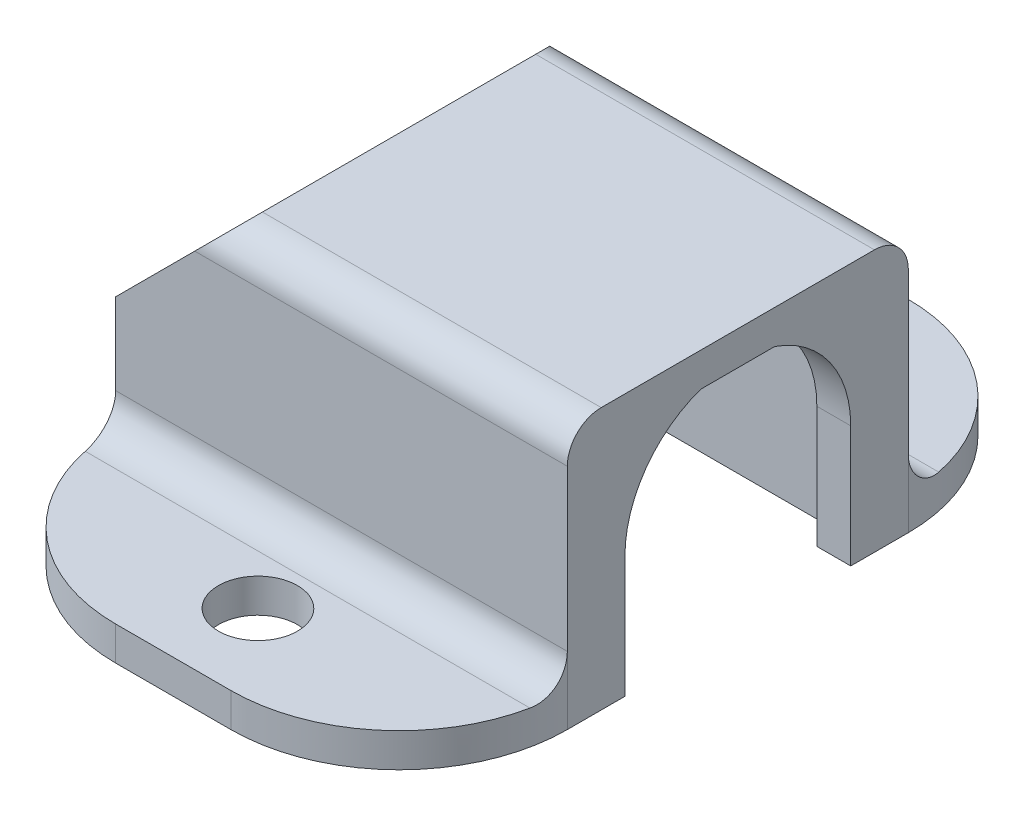
from build123d import *

# Parameters (mm, degrees)
BOSS_EXTRUDE1_DEPTH = 9.3
BOSS_EXTRUDE2_DEPTH = 9.2
BOSS_EXTRUDE3_DEPTH = 1.5
SKETCH4_R           = 1.75
CUT_EXTRUDE4_DEPTH  = 2
FILLET4_R           = 7.45
FILLET5_R           = 1.5
CHAMFER2_START      = -5
CHAMFER2_OUTLINE_W  = 10
CHAMFER2_OUTLINE_H  = 15.1
CHAMFER2_DEPTH      = 4.134035023


with BuildPart() as part:
    # Sketch3 → Boss-Extrude1 (new body)
    with BuildSketch(Plane(origin=(0, 0, 0), x_dir=(0, 0, -1), z_dir=(1, 0, 0))):
        with BuildLine():
            Line((-6.05, -5.375339764), (-6.05, -0.325229596))
            ThreePointArc((-6.05, -0.325229596), (-5.30143663, 2.555003374), (-3.26460533, 4.724659415))
            Line((-3.26460533, 4.724659415), (3.26460533, 4.724659415))
            ThreePointArc((3.26460533, 4.724659415), (5.30143663, 2.555003374), (6.05, -0.325229596))
            Line((6.05, -0.325229596), (6.05, -5.375339764))
            Line((6.05, -5.375339764), (15, -5.375339764))
            Line((15, -5.375339764), (15, -3.875339764))
            Line((15, -3.875339764), (7.55, -3.875339764))
            Line((7.55, -3.875339764), (7.55, 6.224659415))
            Line((7.55, 6.224659415), (-7.55, 6.224659415))
            Line((-7.55, 6.224659415), (-7.55, -3.875339764))
            Line((-7.55, -3.875339764), (-15, -3.875339764))
            Line((-15, -3.875339764), (-15, -5.375339764))
            Line((-15, -5.375339764), (-6.05, -5.375339764))
        make_face()
    extrude(amount=BOSS_EXTRUDE1_DEPTH)

    # Sketch9 → Boss-Extrude2 (add)
    with BuildSketch(Plane(origin=(9.3, 0, 0), x_dir=(0, 0, -1), z_dir=(1, 0, 0))):
        Polygon((7.55, -3.875339764), (7.55, 6.224659415), (-7.55, 6.224659415), (-7.55, -3.875339764), (-15, -3.875339764), (-15, -5.375339764), (-6.05, -5.375339764), (-6.05, 4.724659415), (6.05, 4.724659415), (6.05, -5.375339764), (15, -5.375339764), (15, -3.875339764), align=None)
    extrude(amount=BOSS_EXTRUDE2_DEPTH)

    # Sketch11 → Boss-Extrude3 (add)
    with BuildSketch(Plane(origin=(18.5, 0, 0), x_dir=(0, 0, -1), z_dir=(1, 0, 0))):
        with BuildLine():
            Line((-5, 0), (-5, -5.375339764))
            Line((-5, -5.375339764), (-15, -5.375339764))
            Line((-15, -5.375339764), (-15, -3.875339764))
            Line((-15, -3.875339764), (-7.55, -3.875339764))
            Line((-7.55, -3.875339764), (-7.55, 6.224659415))
            Line((-7.55, 6.224659415), (7.55, 6.224659415))
            Line((7.55, 6.224659415), (7.55, -3.875339764))
            Line((7.55, -3.875339764), (15, -3.875339764))
            Line((15, -3.875339764), (15, -5.375339764))
            Line((15, -5.375339764), (5, -5.375339764))
            Line((5, -5.375339764), (5, 0))
            ThreePointArc((5, 0), (4.07318529, 2.899855444), (1.636335361, 4.724659415))
            Line((1.636335361, 4.724659415), (-1.636335361, 4.724659415))
            ThreePointArc((-1.636335361, 4.724659415), (-4.07318529, 2.899855444), (-5, 0))
        make_face()
    extrude(amount=BOSS_EXTRUDE3_DEPTH)

    # Sketch4 → Cut-Extrude4 (cut)
    with BuildSketch(Plane(origin=(0, -3.875339764, 0), x_dir=(1, 0, 0), z_dir=(0, 1, 0))):
        with Locations(Location((10, -11.25, 0), (0, 0, 270))):
            Circle(SKETCH4_R)
        with Locations(Location((10, 11.25, 0), (0, 0, 270))):
            Circle(SKETCH4_R)
    extrude(amount=-CUT_EXTRUDE4_DEPTH, mode=Mode.SUBTRACT)

    # Fillet4
    fillet4_edges = [part.edges().sort_by_distance(p)[0] for p in [
        (0, -4.625339764, -15),
        (20, -4.625339764, -15),
        (20, -4.625339764, 15),
        (0, -4.625339764, 15),
    ]]
    fillet(fillet4_edges, radius=FILLET4_R)

    # Fillet5
    # the kernel refuses this fillet: 1.5 mm, written as the material it adds along each edge
    with BuildSketch(Plane(origin=(-3.75, -3.875339764, 7.55), x_dir=(0, 0, 1), z_dir=(1, 0, 0))) as fillet5_piece_1_section:
        with BuildLine():
            CenterArc((FILLET5_R, -FILLET5_R), FILLET5_R, 90, 90)
            Line((0, -FILLET5_R), (0, 0))
            Line((0, 0), (FILLET5_R, 0))
        make_face()
    fillet5_piece_1 = extrude(amount=27.5, mode=Mode.PRIVATE)
    fillet5_piece_1 = fillet5_piece_1 & Plane(origin=(7.45, -3.875339764, 7.55), x_dir=(-1, 0, 0), z_dir=(0, -1, 0)) * Cylinder(7.45, 61, mode=Mode.PRIVATE)
    add(fillet5_piece_1)
    with BuildSketch(Plane(origin=(-3.75, -3.875339764, 7.55), x_dir=(0, 0, 1), z_dir=(1, 0, 0))) as fillet5_piece_2_section:
        with BuildLine():
            CenterArc((FILLET5_R, -FILLET5_R), FILLET5_R, 90, 90)
            Line((0, -FILLET5_R), (0, 0))
            Line((0, 0), (FILLET5_R, 0))
        make_face()
    fillet5_piece_2 = extrude(amount=27.5, mode=Mode.PRIVATE)
    fillet5_piece_2 = fillet5_piece_2 & Plane(origin=(12.55, -3.875339764, 7.55), x_dir=(0, 0, 1), z_dir=(0, 1, 0)) * Cylinder(7.45, 61, mode=Mode.PRIVATE)
    add(fillet5_piece_2)
    with BuildSketch(Plane(origin=(-3.75, -3.875339764, -7.55), x_dir=(0, 1, 0), z_dir=(1, 0, 0))) as fillet5_piece_3_section:
        with BuildLine():
            CenterArc((FILLET5_R, -FILLET5_R), FILLET5_R, 90, 90)
            Line((0, -FILLET5_R), (0, 0))
            Line((0, 0), (FILLET5_R, 0))
        make_face()
    fillet5_piece_3 = extrude(amount=27.5, mode=Mode.PRIVATE)
    fillet5_piece_3 = fillet5_piece_3 & Plane(origin=(7.45, -3.875339764, -7.55), x_dir=(-1, 0, 0), z_dir=(0, 1, 0)) * Cylinder(7.45, 62, mode=Mode.PRIVATE)
    add(fillet5_piece_3)
    with BuildSketch(Plane(origin=(-3.75, -3.875339764, -7.55), x_dir=(0, 1, 0), z_dir=(1, 0, 0))) as fillet5_piece_4_section:
        with BuildLine():
            CenterArc((FILLET5_R, -FILLET5_R), FILLET5_R, 90, 90)
            Line((0, -FILLET5_R), (0, 0))
            Line((0, 0), (FILLET5_R, 0))
        make_face()
    fillet5_piece_4 = extrude(amount=27.5, mode=Mode.PRIVATE)
    fillet5_piece_4 = fillet5_piece_4 & Plane(origin=(12.55, -3.875339764, -7.55), x_dir=(1, 0, 0), z_dir=(0, -1, 0)) * Cylinder(7.45, 62, mode=Mode.PRIVATE)
    add(fillet5_piece_4)
    # the kernel refuses this fillet: 1.5 mm, written as the material it takes off along each edge
    with BuildSketch(Plane(origin=(-3.75, 6.224659415, 7.55), x_dir=(0, -1, 0), z_dir=(1, 0, 0)), Plane(origin=(-3.75, 6.224659415, -7.55), x_dir=(0, 0, 1), z_dir=(1, 0, 0))) as fillet5_2_piece_1:
        with BuildLine():
            CenterArc((FILLET5_R, FILLET5_R), FILLET5_R, 180, 90)
            Line((0, FILLET5_R), (0, 0))
            Line((0, 0), (FILLET5_R, 0))
        make_face()
    extrude(amount=27.5, mode=Mode.SUBTRACT)

    # Chamfer2: read off the stored shape, not the designer's step
    # Chamfer2 outline → Chamfer2 (cut)
    with BuildSketch(Plane(origin=(0, 0, 0), x_dir=(0.7071067811865474, 0.7071067811865477, 0), z_dir=(0.7071067811865476, -0.7071067811865476, 0)).offset(CHAMFER2_START)):
        with Locations((4, 0)):
            Rectangle(CHAMFER2_OUTLINE_W, CHAMFER2_OUTLINE_H)
    extrude(amount=CHAMFER2_DEPTH, mode=Mode.SUBTRACT)


solid = part.part
